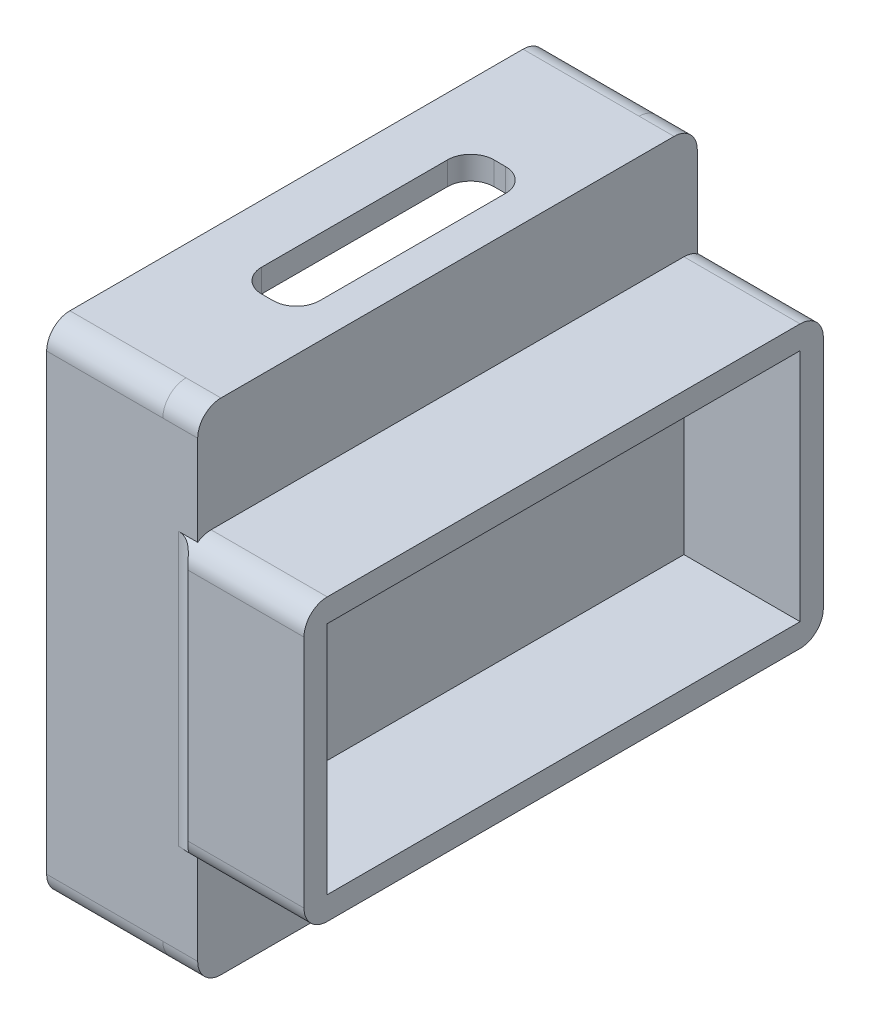
from build123d import *

# Parameters (mm, degrees)
EXTRUDE_1_DEPTH      = 140
SKETCH_3_W           = 49
SKETCH_3_H           = 43
EXTRUDE_1_2_DEPTH    = 2
EXTRUDE_2_DEPTH      = 10
SKETCH_5_W           = 39
SKETCH_5_H           = 38.99999999999997
CUT_EXTRUDE_1_DEPTH  = 5
SKETCH_6_W           = 5.000000000000007
SKETCH_6_H           = 20.000000000000007
CUT_EXTRUDE_2_DEPTH  = 151.46345071146015
SKETCH_8_W           = 20.000000000000007
SKETCH_8_H           = 8
EXTRUDE_4_DEPTH      = 5
SKETCH_9_W           = 29.500000000000007
SKETCH_9_H           = 15.499999999999984
CUT_EXTRUDE_3_DEPTH  = 5
SKETCH_10_R          = 1.5000000000000009
CUT_EXTRUDE_4_DEPTH  = 3
CUT_EXTRUDE_START    = -3
SKETCH_11_R          = 1.5000000000000009
CUT_EXTRUDE_5_DEPTH  = 3
FILLET_1_R           = 2
SKETCH_12_W          = 10.000025874030214
SKETCH_12_H          = 7.999999999999993
CUT_EXTRUDE_6_DEPTH  = 5
FILLET_2_R           = 2
FILLET_3_R           = 2
FILLET_4_R           = 2
SKETCH_14_W          = 49
SKETCH_14_H          = 42.99999999999999
CUT_EXTRUDE_7_DEPTH  = 148.70409608402875
EXTRUDE_5_DEPTH      = 43
SKETCH_16_W          = 37
SKETCH_16_H          = 43.00000000000001
CUT_EXTRUDE_8_DEPTH  = 139
CUT_EXTRUDE_9_DEPTH  = 153.28673612629564
CUT_EXTRUDE_10_DEPTH = 10
CUT_EXTRUDE_11_DEPTH = 10
CUT_EXTRUDE_START_2  = -10
CUT_EXTRUDE_12_DEPTH = 10
FILLET_5_R           = 2
SKETCH_22_W          = 55.90289096918082
SKETCH_22_H          = 52.99366384823722
SKETCH_22_W_2        = 63.39349332103703
SKETCH_22_H_2        = 60.631140756012414
CUT_EXTRUDE_13_DEPTH = 149.4898986463389
SKETCH_24_W          = 48.12895324765829
SKETCH_24_H          = 5.063364692861221
SKETCH_24_W_2        = 50.818083994342985
SKETCH_24_H_2        = 4.997776138063802
CUT_EXTRUDE_14_DEPTH = 104.14795199130229
SKETCH_25_W          = 20.23714780138212
SKETCH_25_H          = 49.24602860882409
CUT_EXTRUDE_15_DEPTH = 106.96933518711913
FILLET_6_R           = 2
EXTRUDE_6_DEPTH      = 10
FILLET_7_R           = 2
FILLET_8_R           = 2


with BuildPart() as part:
    # 草图1 → Extrude 1 (new body)
    with BuildSketch(Plane.XY):
        Polygon((-24.49999999999998, 21.499999999999993), (24.50000000000002, 21.5), (24.50000000000002, -21.5), (-24.49999999999998, -21.500000000000007), align=None)
        Polygon((-22.49999999999998, 19.499999999999993), (22.50000000000002, 19.5), (22.50000000000002, -19.5), (-22.49999999999998, -19.500000000000007), align=None, mode=Mode.SUBTRACT)
    extrude(amount=EXTRUDE_1_DEPTH)

    # 草图3 → Extrude 1 2 (add)
    with BuildSketch(Plane(origin=(0, 0, 0), x_dir=(-1, 0, 0), z_dir=(0, 0, -1))):
        Rectangle(SKETCH_3_W, SKETCH_3_H)
    extrude(amount=EXTRUDE_1_2_DEPTH)

    # 草图4 → 凸台-拉伸2 (add)
    with BuildSketch(Plane.ZY.offset(24.49999999999998)):
        Polygon((90.5, -21.499999999999996), (47.50000000000001, -21.499999999999996), (47.50000000000001, 21.499999999999993), (90.50000000000001, 21.499999999999993), align=None)
    extrude(amount=EXTRUDE_2_DEPTH)

    # 草图5 → 切除-拉伸1 (cut)
    with BuildSketch(Plane.ZY.offset(34.49999999999998)):
        with Locations((69, 1.78e-15)):
            Rectangle(SKETCH_5_W, SKETCH_5_H)
    extrude(amount=-CUT_EXTRUDE_1_DEPTH, mode=Mode.SUBTRACT)

    # 草图6 → 切除-拉伸2 (cut, through all)
    with BuildSketch(Plane(origin=(-3.32e-15, 21.499999999999996, 0), x_dir=(1, 1.5e-16, 0), z_dir=(-1.5e-16, 1, 0))):
        with Locations((-26.99999999999998, -69.00000000000001)):
            Rectangle(SKETCH_6_W, SKETCH_6_H)
    extrude(amount=-CUT_EXTRUDE_2_DEPTH, mode=Mode.SUBTRACT)

    # 草图8 → 凸台-拉伸4 (add)
    with BuildSketch(Plane.ZY.offset(24.499999999999975)):
        with Locations((69.00000000000001, 4.4e-16)):
            Rectangle(SKETCH_8_W, SKETCH_8_H)
    extrude(amount=EXTRUDE_4_DEPTH)

    # 草图9 → 切除-拉伸3 (cut)
    with BuildSketch(Plane.ZY.offset(29.499999999999982)):
        Polygon((83.75000000000001, 3.9999999999999964), (54.25000000000001, 3.9999999999999964), (54.25000000000001, 19.49999999999999), (83.75, 19.49999999999999), align=None)
        with Locations((69.00000000000001, -11.749999999999996)):
            Rectangle(SKETCH_9_W, SKETCH_9_H)
    extrude(amount=-CUT_EXTRUDE_3_DEPTH, mode=Mode.SUBTRACT)

    # 草图10 → 切除-拉伸4 (cut)
    with BuildSketch(Plane.XZ.offset(4)):
        with Locations((-26.99999999999998, 78.5)):
            Circle(SKETCH_10_R)
        with Locations(Location((-26.999999999999975, 59.500000000000014, 0), (0, 0, 180))):
            Circle(SKETCH_10_R)
    extrude(amount=-CUT_EXTRUDE_4_DEPTH, mode=Mode.SUBTRACT)

    # 草图11 → 切除-拉伸5 (cut)
    with BuildSketch(Plane(origin=(-6.2e-16, 4.000000000000001, 0), x_dir=(1, 1.5e-16, 0), z_dir=(-1.5e-16, 1, 0)).offset(CUT_EXTRUDE_START)):
        with Locations(Location((-26.999999999999975, -59.500000000000014, 0), (0, 0, 180))):
            Circle(SKETCH_11_R)
        with Locations((-26.99999999999998, -78.5)):
            Circle(SKETCH_11_R)
    extrude(amount=CUT_EXTRUDE_5_DEPTH, mode=Mode.SUBTRACT)

    # 圆角1
    fillet_1_edges = [part.edges().sort_by_distance(p)[0] for p in [
        (-24.49999999999998, 20.499999999999993, 79.00000000000001),
        (-24.49999999999998, 20.499999999999993, 59.00000000000001),
        (-29.49999999999998, -20.499999999999993, 79.00000000000001),
        (-29.499999999999986, 20.499999999999993, 79.00000000000001),
        (-29.49999999999998, -20.499999999999993, 59.00000000000001),
        (-29.499999999999986, 20.499999999999993, 59.00000000000001),
        (-24.49999999999997, -20.5, 59.00000000000001),
        (-24.49999999999997, -20.5, 79.00000000000001),
    ]]
    fillet(fillet_1_edges, radius=FILLET_1_R)

    # 草图12 → 切除-拉伸6 (cut)
    with BuildSketch(Plane.ZY.offset(29.499999999999982)):
        with Locations((69, 0)):
            Rectangle(SKETCH_12_W, SKETCH_12_H)
    extrude(amount=-CUT_EXTRUDE_6_DEPTH, mode=Mode.SUBTRACT)

    # 圆角2
    fillet_2_edges = [part.edges().sort_by_distance(p)[0] for p in [
        (-31.99999999999998, -19.499999999999986, 49.50000000000001),
        (-31.99999999999998, 19.49999999999999, 49.50000000000001),
        (-31.99999999999998, 19.49999999999999, 88.5),
        (-31.99999999999998, -19.499999999999986, 88.5),
    ]]
    fillet(fillet_2_edges, radius=FILLET_2_R)

    # 圆角3
    fillet_3_edges = [part.edges().sort_by_distance(p)[0] for p in [
        (-29.49999999999998, 21.499999999999993, 47.50000000000001),
        (-29.49999999999998, -21.499999999999996, 47.50000000000001),
        (-29.49999999999998, -21.499999999999996, 90.5),
        (-29.49999999999998, 21.499999999999993, 90.50000000000001),
    ]]
    fillet(fillet_3_edges, radius=FILLET_3_R)

    # 圆角4
    fillet_4_edges = [part.edges().sort_by_distance(p)[0] for p in [
        (-26.999999999999982, 3.9999999999999964, 83.75000000000001),
        (-26.999999999999982, 19.49999999999999, 54.25000000000001),
        (-26.999999999999982, 3.9999999999999964, 54.25000000000001),
        (-26.999999999999982, 19.49999999999999, 83.75),
        (-26.999999999999982, -4.000000000000005, 54.25000000000001),
        (-26.999999999999982, -19.49999999999999, 83.75000000000001),
        (-26.999999999999982, -19.49999999999999, 54.25000000000001),
        (-26.999999999999982, -4.000000000000005, 83.75000000000001),
    ]]
    fillet(fillet_4_edges, radius=FILLET_4_R)

    # 草图14 → 切除-拉伸7 (cut, through all)
    with BuildSketch(Plane.XY.offset(140)):
        Rectangle(SKETCH_14_W, SKETCH_14_H)
    extrude(amount=-CUT_EXTRUDE_7_DEPTH, mode=Mode.SUBTRACT)

    # 草图15 → 凸台-拉伸5 (add)
    with BuildSketch(Plane(origin=(-24.49999999999998, 0, 0), x_dir=(0, 0, -1), z_dir=(1, 0, 0))):
        Polygon((1.999999999999988, -24.499999999999993), (-140, -24.50000000000001), (-140, 24.49999999999999), (1.999999999999988, 24.500000000000007), align=None)
    extrude(amount=EXTRUDE_5_DEPTH)

    # 草图16 → 切除-拉伸8 (cut)
    with BuildSketch(Plane(origin=(0, 0, -1.999999999999988), x_dir=(-1, 0, 0), z_dir=(0, 0, -1))):
        with Locations((2.9999999999999813, 3.55e-15)):
            Rectangle(SKETCH_16_W, SKETCH_16_H)
    extrude(amount=-CUT_EXTRUDE_8_DEPTH, mode=Mode.SUBTRACT)

    # 草图17 → 切除-拉伸9 (cut, through all)
    with BuildSketch(Plane.XZ.offset(24.499999999999993)):
        with BuildLine():
            Line((-11.999999999999824, 112), (6.000000000000174, 112))
            ThreePointArc((6.000000000000174, 112), (9.000000000000174, 115.00000000000001), (6.00000000000014, 117.99999999999989))
            Line((6.00000000000014, 117.99999999999989), (-11.999999999999854, 117.99999999999969))
            ThreePointArc((-11.999999999999854, 117.99999999999969), (-14.999999999999512, 114.99999999999999), (-11.999999999999824, 112))
        make_face()
        with BuildLine():
            Line((-11.999999999999668, 97), (6.00000000000033, 97))
            ThreePointArc((6.00000000000033, 97), (9.00000000000033, 100.00000000000001), (6.000000000000297, 102.99999999999947))
            Line((6.000000000000297, 102.99999999999947), (-11.999999999999698, 102.99999999999929))
            ThreePointArc((-11.999999999999698, 102.99999999999929), (-14.999999999998957, 99.99999999999999), (-11.999999999999668, 97))
        make_face()
        with BuildLine():
            Line((-11.999999999999512, 82), (6.000000000000487, 82))
            ThreePointArc((6.000000000000487, 82), (9.000000000000487, 85.00000000000001), (6.000000000000453, 87.99999999999908))
            Line((6.000000000000453, 87.99999999999908), (-11.999999999999542, 87.99999999999889))
            ThreePointArc((-11.999999999999542, 87.99999999999889), (-14.999999999998403, 84.99999999999999), (-11.999999999999512, 82))
        make_face()
        with BuildLine():
            Line((-11.999999999999355, 67.00000000000058), (6.000000000000643, 67))
            ThreePointArc((6.000000000000643, 67), (9.000000000000643, 70), (6.000000000000643, 73.00000000000034))
            Line((6.000000000000643, 73.00000000000034), (-11.999999999999355, 73.00000000000034))
            ThreePointArc((-11.999999999999355, 73.00000000000034), (-14.999999999999696, 70), (-11.999999999999355, 67.00000000000058))
        make_face()
        with BuildLine():
            Line((-11.999999999999199, 51.99999999999935), (6.000000000000797, 51.99999999999936))
            ThreePointArc((6.000000000000797, 51.99999999999936), (8.999999999999595, 54.99999999999816), (6.000000000000797, 57.99999999999685))
            Line((6.000000000000797, 57.99999999999685), (-11.999999999999199, 57.99999999999686))
            ThreePointArc((-11.999999999999199, 57.99999999999686), (-14.999999999997955, 54.9999999999981), (-11.999999999999199, 51.99999999999935))
        make_face()
        with BuildLine():
            Line((-11.999999999999043, 36.99999999999916), (6.000000000000953, 36.999999999999154))
            ThreePointArc((6.000000000000953, 36.999999999999154), (8.99999999999956, 39.99999999999776), (6.000000000000953, 42.999999999996184))
            Line((6.000000000000953, 42.999999999996184), (-11.999999999999043, 42.99999999999625))
            ThreePointArc((-11.999999999999043, 42.99999999999625), (-14.999999999997586, 39.999999999997705), (-11.999999999999043, 36.99999999999916))
        make_face()
        with BuildLine():
            Line((-11.999999999998886, 21.99999999999899), (6.000000000001109, 21.999999999998987))
            ThreePointArc((6.000000000001109, 21.999999999998987), (8.999999999999478, 24.999999999997357), (6.000000000001109, 27.999999999995616))
            Line((6.000000000001109, 27.999999999995616), (-11.999999999998886, 27.999999999995612))
            ThreePointArc((-11.999999999998886, 27.999999999995612), (-14.999999999997195, 24.999999999997303), (-11.999999999998886, 21.99999999999899))
        make_face()
        with BuildLine():
            Line((-11.99999999999873, 6.9999999999987645), (6.000000000001266, 6.9999999999987645))
            ThreePointArc((6.000000000001266, 6.9999999999987645), (8.999999999999456, 9.999999999996955), (6.000000000001266, 12.999999999995037))
            Line((6.000000000001266, 12.999999999995037), (-11.99999999999873, 12.999999999995037))
            ThreePointArc((-11.99999999999873, 12.999999999995037), (-14.999999999996867, 9.9999999999969), (-11.99999999999873, 6.9999999999987645))
        make_face()
    extrude(amount=-CUT_EXTRUDE_9_DEPTH, mode=Mode.SUBTRACT)

    # 草图18 → 切除-拉伸10 (cut)
    with BuildSketch(Plane(origin=(18.500000000000018, 0, 0), x_dir=(0, 0, -1), z_dir=(1, 0, 0))):
        with BuildLine():
            Line((-118.00000000000001, 12), (-118.00000000000001, -12))
            ThreePointArc((-118.00000000000001, -12), (-115, -15.000000000000014), (-112, -12))
            Line((-112, -12), (-112, 12))
            ThreePointArc((-112, 12), (-115, 15), (-118.00000000000001, 12))
        make_face()
        with BuildLine():
            Line((-103.00000000000001, 12), (-103.00000000000001, -12))
            ThreePointArc((-103.00000000000001, -12), (-100, -15.000000000000014), (-97, -12))
            Line((-97, -12), (-97, 12))
            ThreePointArc((-97, 12), (-100, 15), (-103.00000000000001, 12))
        make_face()
        with BuildLine():
            Line((-88.00000000000001, 12), (-88.00000000000001, -12))
            ThreePointArc((-88.00000000000001, -12), (-85, -15.000000000000014), (-82, -12))
            Line((-82, -12), (-82, 12))
            ThreePointArc((-82, 12), (-85, 15), (-88.00000000000001, 12))
        make_face()
        with BuildLine():
            Line((-73.00000000000001, 12), (-73.00000000000001, -12))
            ThreePointArc((-73.00000000000001, -12), (-70, -15.000000000000014), (-67, -12))
            Line((-67, -12), (-67, 12))
            ThreePointArc((-67, 12), (-70, 15), (-73.00000000000001, 12))
        make_face()
        with BuildLine():
            Line((-58.00000000000001, 12), (-58.00000000000001, -12))
            ThreePointArc((-58.00000000000001, -12), (-55.00000000000001, -15), (-52.00000000000001, -12))
            Line((-52.00000000000001, -12), (-52.00000000000001, 12))
            ThreePointArc((-52.00000000000001, 12), (-55.00000000000001, 15), (-58.00000000000001, 12))
        make_face()
        with BuildLine():
            Line((-43.00000000000001, 12), (-43.00000000000001, -12))
            ThreePointArc((-43.00000000000001, -12), (-40.00000000000001, -15), (-37.00000000000001, -12))
            Line((-37.00000000000001, -12), (-37.00000000000001, 12))
            ThreePointArc((-37.00000000000001, 12), (-40.00000000000001, 15), (-43.00000000000001, 12))
        make_face()
        with BuildLine():
            Line((-28.00000000000001, 12), (-28.00000000000001, -12))
            ThreePointArc((-28.00000000000001, -12), (-25.000000000000007, -15.000000000000004), (-22.000000000000007, -12))
            Line((-22.000000000000007, -12), (-22.000000000000007, 12))
            ThreePointArc((-22.000000000000007, 12), (-25.000000000000007, 15), (-28.00000000000001, 12))
        make_face()
        with BuildLine():
            Line((-13.00000000000001, 12), (-13.00000000000001, -12))
            ThreePointArc((-13.00000000000001, -12), (-10.000000000000009, -15.000000000000002), (-7.000000000000006, -12))
            Line((-7.000000000000006, -12), (-7.000000000000006, 12))
            ThreePointArc((-7.000000000000006, 12), (-10.000000000000009, 15.000000000000004), (-13.00000000000001, 12))
        make_face()
    extrude(amount=-CUT_EXTRUDE_10_DEPTH, mode=Mode.SUBTRACT)

    # 草图19 → 切除-拉伸11 (cut)
    with BuildSketch(Plane.ZY.offset(24.49999999999998)):
        with BuildLine():
            Line((11.000000000000004, 12), (11.000000000000007, -12))
            ThreePointArc((11.000000000000007, -12), (8.000000000000007, -15), (5.000000000000007, -12))
            Line((5.000000000000007, -12), (5.000000000000004, 12))
            ThreePointArc((5.000000000000004, 12), (8.000000000000004, 15), (11.000000000000004, 12))
        make_face()
        with BuildLine():
            Line((20.000000000000004, 12), (20.000000000000007, -12))
            ThreePointArc((20.000000000000007, -12), (23.000000000000007, -15), (26.000000000000007, -12))
            Line((26.000000000000007, -12), (26.000000000000004, 12))
            ThreePointArc((26.000000000000004, 12), (23.000000000000004, 15), (20.000000000000004, 12))
        make_face()
        with BuildLine():
            Line((35, 12), (35, -12))
            ThreePointArc((35, -12), (38.00000000000001, -15.000000000000007), (41.00000000000001, -12))
            Line((41.00000000000001, -12), (41, 12))
            ThreePointArc((41, 12), (38.00000000000001, 14.999999999999993), (35, 12))
        make_face()
    extrude(amount=-CUT_EXTRUDE_11_DEPTH, mode=Mode.SUBTRACT)

    # 草图21 → 切除-拉伸12 (cut)
    with BuildSketch(Plane.ZY.offset(24.49999999999998).offset(CUT_EXTRUDE_START_2)):
        with BuildLine():
            Line((112, 11.999999999999895), (112, -12.000000000000107))
            ThreePointArc((112, -12.000000000000107), (115, -15.000000000000107), (118.00000000000001, -12.000000000000107))
            Line((118.00000000000001, -12.000000000000107), (118.00000000000001, 11.999999999999895))
            ThreePointArc((118.00000000000001, 11.999999999999895), (115.00000000000018, 14.999999999999725), (112, 11.999999999999895))
        make_face()
        with BuildLine():
            Line((97, 11.999999999999789), (97, -12.000000000000211))
            ThreePointArc((97, -12.000000000000211), (100, -15.000000000000211), (103.00000000000001, -12.000000000000211))
            Line((103.00000000000001, -12.000000000000211), (103.00000000000001, 11.999999999999789))
            ThreePointArc((103.00000000000001, 11.999999999999789), (100, 14.999999999999803), (97, 11.999999999999789))
        make_face()
    extrude(amount=CUT_EXTRUDE_12_DEPTH, mode=Mode.SUBTRACT)

    # 圆角5
    fillet_5_edges = [part.edges().sort_by_distance(p)[0] for p in [
        (-24.49999999999998, -24.5, 69.00000000000001),
        (-24.49999999999998, 24.5, 69),
        (18.50000000000002, -24.5, 69.00000000000001),
        (18.50000000000002, 24.5, 69),
    ]]
    fillet(fillet_5_edges, radius=FILLET_5_R)

    # 草图22 → 切除-拉伸13 (cut, through all)
    with BuildSketch(Plane.ZY.offset(24.49999999999998)):
        with Locations((19.54855451540959, -1.9968319241186077)):
            Rectangle(SKETCH_22_W, SKETCH_22_H)
        with Locations((122.19674666051851, 5.815570378006207)):
            Rectangle(SKETCH_22_W_2, SKETCH_22_H_2)
    extrude(amount=-CUT_EXTRUDE_13_DEPTH, mode=Mode.SUBTRACT)

    # 草图24 → 切除-拉伸14 (cut, through all)
    with BuildSketch(Plane.ZY.offset(24.49999999999998)):
        with Locations((71.56447662382917, 24.031682346430618)):
            Rectangle(SKETCH_24_W, SKETCH_24_H)
        with Locations((72.9090419971715, -23.9988880690319)):
            Rectangle(SKETCH_24_W_2, SKETCH_24_H_2)
    extrude(amount=-CUT_EXTRUDE_14_DEPTH, mode=Mode.SUBTRACT)


with BuildPart() as cut_extrude_14_piece_1:
    # of the separate pieces the step leaves, piece 1, a body of its own (cut_extrude_14_pieces)
    add(part.part.solids().sort_by_distance((-24.5, 21.5, 90.5))[0])

    # 圆角6
    fillet_6_edges = [cut_extrude_14_piece_1.edges().sort_by_distance(p)[0] for p in [
        (-22.99999999999998, 21.500000000000007, 47.500000000000014),
        (-22.99999999999998, -21.5, 47.500000000000014),
        (-22.99999999999998, -21.5, 90.5),
        (-22.99999999999998, 21.500000000000007, 90.5),
    ]]
    fillet(fillet_6_edges, radius=FILLET_6_R)

    # 草图26 → 凸台-拉伸6 (add)
    with BuildSketch(Plane(origin=(-21.499999999999982, 0, 0), x_dir=(0, 0, -1), z_dir=(1, 0, 0))):
        Polygon((-46.65000000000001, -12.100000000000001), (-91.35000000000001, -12.100000000000007), (-91.35000000000001, 12.099999999999993), (-46.65000000000001, 12.099999999999998), align=None)
        Polygon((-48.65, -10.1), (-89.35, -10.100000000000009), (-89.35, 10.09999999999999), (-48.65, 10.1), align=None, mode=Mode.SUBTRACT)
    extrude(amount=EXTRUDE_6_DEPTH)

    # 圆角7
    # the kernel refuses this fillet: 2 mm, written as the material it adds along each edge
    with BuildSketch(Plane(origin=(-21.499999999999982, -12.100000000000005, 90.5), x_dir=(-1, 0, 0), z_dir=(0, 1, 0))) as fillet_7_piece_1:
        with BuildLine():
            CenterArc((1.6363068172035504, 2), FILLET_7_R, 215.09963219525838, 54.90036780474162)
            Line((5.48184e-12, 0.8500000000038597), (0, 0))
            Line((0, 0), (1.6363068172035504, 0))
        make_face()
    extrude(amount=24.199999999999996)
    with BuildSketch(Plane(origin=(-21.499999999999982, 12.099999999999998, 47.50000000000001), x_dir=(-1, 0, 0), z_dir=(0, -1, 0))) as fillet_7_piece_2:
        with BuildLine():
            CenterArc((1.6363068172036037, 2), FILLET_7_R, 215.09963219525787, 54.90036780474213)
            Line((5.52447e-12, 0.8500000000038739), (0, 0))
            Line((0, 0), (1.6363068172036037, 0))
        make_face()
    extrude(amount=24.2)

    # 圆角8
    fillet_8_edges = [cut_extrude_14_piece_1.edges().sort_by_distance(p)[0] for p in [
        (-16.499999999999982, 12.099999999999998, 46.65000000000001),
        (-16.499999999999982, -12.100000000000001, 46.65000000000001),
        (-16.499999999999982, -12.100000000000007, 91.35000000000001),
        (-16.499999999999982, 12.099999999999993, 91.35000000000001),
    ]]
    fillet(fillet_8_edges, radius=FILLET_8_R)


with BuildPart() as cut_extrude_14_piece_2:
    # of the separate pieces the step leaves, piece 2, a body of its own (cut_extrude_14_pieces)
    add(part.part.solids().sort_by_distance((15.5, 21.5, 90.5))[0])

    # 草图25 → 切除-拉伸15 (cut, through all)
    with BuildSketch(Plane(origin=(0, 21.500000000000007, 0), x_dir=(1, 0, 0), z_dir=(0, 1, 0))):
        with Locations((18.69507721922934, -67.99850292450483)):
            Rectangle(SKETCH_25_W, SKETCH_25_H)
    extrude(amount=-CUT_EXTRUDE_15_DEPTH, mode=Mode.SUBTRACT)


solid = cut_extrude_14_piece_1.part
